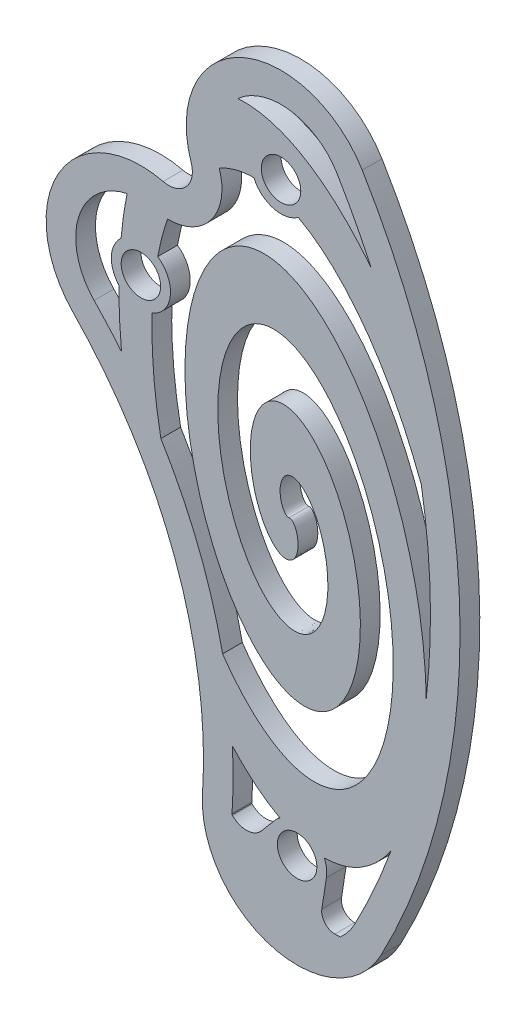
from build123d import *

# Parameters (mm, degrees)
SKETCH1_R             = 3
SKETCH1_R_2           = 2
BOSS_EXTRUDE1_DEPTH   = 2
BOSS_EXTRUDE1_2_DEPTH = 2
SKETCH2_R             = 2
BOSS_EXTRUDE2_DEPTH   = 2
SKETCH3_R             = 2
BOSS_EXTRUDE3_DEPTH   = 2
BOSS_EXTRUDE4_START   = -2
BOSS_EXTRUDE4_DEPTH   = 2
BOSS_EXTRUDE5_START   = -2
BOSS_EXTRUDE5_DEPTH   = 2


# Read off the part's stored shape, not the designer's step: Boss-Extrude4
with BuildPart() as part:
    # Sketch1 → Boss-Extrude1 (new body)
    with BuildSketch(Plane.XY):
        with Locations((10, 29.870554062)):
            Circle(SKETCH1_R)
        with Locations((10, 29.870554062)):
            Circle(SKETCH1_R_2, mode=Mode.SUBTRACT)
    extrude(amount=BOSS_EXTRUDE1_DEPTH)



with BuildPart() as body_2:
    # Sketch1 → Boss-Extrude1 2 (new body)
    with BuildSketch(Plane.XY):
        with BuildLine():
            ThreePointArc((15.091212356, 42.293512153), (14.584137621, 39.9164312), (12.258800619, 39.209008787))
            ThreePointArc((12.258800619, 39.209008787), (1.657748338, 34.63665877), (3.102421083, 23.182331432))
            ThreePointArc((3.102421083, 23.182331432), (13.45947408, 6.707290479), (16.245943176, -12.552281456))
            ThreePointArc((16.245943176, -12.552281456), (23.216428529, -22.421663779), (34.325745067, -17.67029981))
            ThreePointArc((34.325745067, -17.67029981), (42.319361068, 16.562449764), (32.432857738, 50.297240295))
            ThreePointArc((32.432857738, 50.297240295), (20.177538702, 54.061889951), (15.091212356, 42.293512153))
        make_face()
        with BuildLine():
            ThreePointArc((5.256175124, 25.270714426), (4.262598307, 33.148452924), (11.55349503, 36.293096575))
            ThreePointArc((11.55349503, 36.293096575), (16.793832724, 37.887331017), (17.936567237, 43.244277949))
            ThreePointArc((17.936567237, 43.244277949), (21.434699226, 51.338005331), (29.863321501, 48.748859357))
            ThreePointArc((29.863321501, 48.748859357), (39.320523815, 16.478932529), (31.674014102, -16.267330498))
            ThreePointArc((31.674014102, -16.267330498), (24.033557532, -19.535091384), (19.239591096, -12.747402263))
            ThreePointArc((19.239591096, -12.747402263), (16.275061788, 7.742889755), (5.256175124, 25.270714426))
        make_face(mode=Mode.SUBTRACT)
    extrude(amount=BOSS_EXTRUDE1_2_DEPTH)


with BuildPart() as body_3:
    # Sketch2 → Boss-Extrude2 (new body)
    with BuildSketch(Plane.XY.offset(2)):
        with BuildLine():
            ThreePointArc((22.87015374, -12.708717616), (22.833523349, -13.209136305), (22.880808412, -13.708660853))
            ThreePointArc((22.880808412, -13.708660853), (22.954091233, -14.019699042), (23.06004252, -14.321177817))
            ThreePointArc((23.06004252, -14.321177817), (23.289499578, -14.767395375), (23.590116881, -15.169128978))
            ThreePointArc((23.590116881, -15.169128978), (23.814721384, -15.396434816), (24.062229535, -15.598560624))
            ThreePointArc((24.062229535, -15.598560624), (24.490566436, -15.859880639), (24.956465651, -16.046156166))
            ThreePointArc((24.956465651, -16.046156166), (25.266605535, -16.123152136), (25.583175807, -16.166722649))
            ThreePointArc((25.583175807, -16.166722649), (26.084933355, -16.166604906), (26.579653345, -16.082862552))
            ThreePointArc((26.579653345, -16.082862552), (26.884489132, -15.986996656), (27.177398598, -15.859250142))
            ThreePointArc((27.177398598, -15.859250142), (27.605612807, -15.597729127), (27.984250876, -15.268496894))
            ThreePointArc((27.984250876, -15.268496894), (28.194496651, -15.027848101), (28.377952594, -14.766201309))
            ThreePointArc((28.377952594, -14.766201309), (28.607200206, -14.319876111), (28.758853867, -13.841585594))
            ThreePointArc((28.758853867, -13.841585594), (28.814670087, -13.511460777), (28.833353061, -13.177172292))
            ThreePointArc((28.833353061, -13.177172292), (26.068302031, -10.186386612), (22.87015374, -12.708717616))
        make_face()
        with Locations((25.833353061, -13.177172292)):
            Circle(SKETCH2_R, mode=Mode.SUBTRACT)
    extrude(amount=-BOSS_EXTRUDE2_DEPTH)


with BuildPart() as body_4:
    # Sketch3 → Boss-Extrude3 (new body)
    with BuildSketch(Plane.XY.offset(2)):
        with BuildLine():
            ThreePointArc((21.213127456, 45.100789395), (21.294560788, 44.60568409), (21.457372687, 44.131075898))
            ThreePointArc((21.457372687, 44.131075898), (24.820553864, 42.402522494), (27.20370128, 45.338419783))
            ThreePointArc((27.20370128, 45.338419783), (27.135154617, 45.976057091), (26.932647056, 46.584555792))
            ThreePointArc((26.932647056, 46.584555792), (26.686788767, 47.021950754), (26.371470065, 47.412251621))
            ThreePointArc((26.371470065, 47.412251621), (25.927248759, 47.793900202), (25.417343402, 48.081970912))
            ThreePointArc((25.417343402, 48.081970912), (25.183659323, 48.173853124), (24.943110029, 48.245871365))
            ThreePointArc((24.943110029, 48.245871365), (24.614103786, 48.3102155), (24.279972743, 48.33745007))
            ThreePointArc((24.279972743, 48.33745007), (23.779067576, 48.308215435), (23.290040859, 48.195905502))
            ThreePointArc((23.290040859, 48.195905502), (22.976930544, 48.076125676), (22.679139226, 47.922159426))
            ThreePointArc((22.679139226, 47.922159426), (22.269839548, 47.631927751), (21.91463657, 47.277538848))
            ThreePointArc((21.91463657, 47.277538848), (21.7125776, 47.010036608), (21.541625922, 46.721660466))
            ThreePointArc((21.541625922, 46.721660466), (21.348319465, 46.258634263), (21.234887762, 45.769866527))
            ThreePointArc((21.234887762, 45.769866527), (21.205286628, 45.435936821), (21.213127456, 45.100789395))
        make_face()
        with Locations((24.20370128, 45.338419783)):
            Circle(SKETCH3_R, mode=Mode.SUBTRACT)
    extrude(amount=-BOSS_EXTRUDE3_DEPTH)


with BuildPart() as part_1:
    add(part.part)

    add(body_2.part)  # Boss-Extrude4 merges body 2

    add(body_3.part)  # Boss-Extrude4 merges body 3

    add(body_4.part)  # Boss-Extrude4 merges body 4
    # Boss-Extrude4 outline → Boss-Extrude4 (add)
    with BuildSketch(Plane(origin=(0, 0, 0), x_dir=(-1, 0, 0), z_dir=(0, 0, -1)).offset(BOSS_EXTRUDE4_START)):
        with BuildLine():
            ThreePointArc((-28.58514535, -11.982333724), (-26.633604436, -10.285875396), (-24.087522739, -10.737484507))
            add(Edge.make_bspline(
                [(-24.087522739, -10.737484507), (-23.597444838, -10.473454504), (-22.53325726, -9.81907558), (-21.297213455, -8.858268085), (-20.168950346, -7.779397806), (-19.483061822, -7.048046859), (-19.273300207, -6.81706491)],
                knots=[0.317368676, 0.317368676, 0.317368676, 0.317368676, 0.317368676, 0.321512116, 0.326650739, 0.328972522, 0.328972522, 0.328972522, 0.328972522, 0.328972522], degree=4))
            ThreePointArc((-19.273300207, -6.81706491), (-18.921825691, -3.008226651), (-18.27990932, 0.762546027))
            add(Edge.make_bspline(
                [(-25.018527171, 16.080623746), (-25.007693139, 16.078235173), (-24.985741755, 16.075058431), (-24.942847658, 16.07307706), (-24.896403955, 16.081542367), (-24.848675665, 16.096715556), (-24.804135478, 16.117926692), (-24.751377729, 16.150118281), (-24.696796768, 16.192961191), (-24.641479104, 16.246409134), (-24.586326833, 16.310319075), (-24.538555941, 16.373994177), (-24.483551758, 16.456892678), (-24.424263096, 16.560566209), (-24.365238704, 16.682417076), (-24.308356773, 16.822644776), (-24.249016227, 16.995981312), (-24.192586764, 17.203687492), (-24.144403071, 17.450166622), (-24.104136519, 17.806715376), (-24.101883621, 18.165931867), (-24.139854562, 18.523591015), (-24.226489558, 18.874327088), (-24.33077849, 19.146942428), (-24.477510007, 19.402471036), (-24.675295001, 19.625265165), (-24.908646735, 19.776705896), (-25.154324783, 19.848802012), (-25.387193511, 19.857070622), (-25.5958073, 19.824140216), (-25.832853097, 19.74670586), (-26.089087017, 19.61493629), (-26.429547099, 19.37295286), (-26.819659272, 18.988181092), (-27.210071761, 18.483230462), (-27.605704192, 17.830707156), (-27.953760548, 17.113710635), (-28.255337087, 16.33911261), (-28.509025798, 15.511834862), (-28.706449013, 14.669389397), (-28.849196058, 13.816090633), (-28.959084041, 12.740077117), (-28.97398092, 11.651856328), (-28.882341342, 10.5602765), (-28.657642355, 9.483462588), (-28.378704316, 8.63805265), (-28.029107016, 7.937930277), (-27.633329616, 7.39174831), (-27.14774402, 6.919433306), (-26.625210825, 6.585130114), (-25.981008244, 6.391589382), (-25.266867426, 6.399539843), (-24.640446567, 6.550441282), (-23.955244965, 6.852871052), (-23.241973748, 7.324790248), (-22.327413604, 8.142862932), (-21.319782187, 9.387113747), (-20.35213267, 10.981801334), (-19.539097058, 12.769414914), (-18.940149837, 14.462435063), (-18.407330909, 16.38531453), (-17.985540992, 18.540869552), (-17.73171818, 21.093654501), (-17.79248824, 23.630699448), (-18.107028258, 25.749714837), (-18.578852642, 27.429297472), (-19.087157173, 28.680098268), (-19.782798729, 29.8642487), (-20.713909679, 30.907481282), (-21.849685109, 31.622280614), (-23.086602526, 31.907196227), (-24.52163539, 31.808934883), (-25.914685039, 31.281275211), (-27.256619811, 30.389302912), (-28.529473149, 29.201057105), (-29.572315479, 27.980093833), (-30.73619453, 26.345509965), (-31.935476279, 24.255824652), (-33.162286863, 21.541082505), (-34.129510468, 18.634937931), (-34.783871494, 15.970714879), (-35.201268829, 13.581951731), (-35.436556336, 11.65637596), (-35.602860885, 9.237011339), (-35.586694761, 6.745242943), (-35.348119564, 4.197535437), (-34.811158782, 1.629939214), (-34.125630672, -0.46383912), (-33.143507533, -2.442469955), (-31.786991446, -4.193550884), (-30.040271719, -5.449646807), (-28.035645542, -5.955810981), (-25.773038611, -5.714469287), (-23.493037163, -4.689598277), (-21.261248667, -2.940184163), (-19.688834894, -1.174306293), (-18.740035252, 0.094799491), (-18.27990932, 0.762546027)],
                knots=[0.010656411, 0.010656411, 0.010656411, 0.010656411, 0.010656411, 0.010720232, 0.010784053, 0.010847874, 0.010911695, 0.010975516, 0.011039337, 0.011166979, 0.011269874, 0.011372768, 0.011475663, 0.011578557, 0.011784347, 0.011990136, 0.012175564, 0.012360991, 0.012731847, 0.013102702, 0.013473558, 0.014215269, 0.014586124, 0.01495698, 0.015338869, 0.015720757, 0.016102646, 0.016484535, 0.016756286, 0.017028037, 0.017299788, 0.01757154, 0.018042056, 0.018512572, 0.019453605, 0.020394637, 0.02133567, 0.022454002, 0.023572334, 0.024690666, 0.025808998, 0.02692733, 0.028045662, 0.030282326, 0.031430663, 0.032578999, 0.033727335, 0.034875672, 0.035462208, 0.036048744, 0.037221817, 0.038049746, 0.038877674, 0.039705603, 0.040533532, 0.041908376, 0.04328322, 0.046032909, 0.048782597, 0.051532286, 0.053424027, 0.055315767, 0.059099249, 0.06288273, 0.066666211, 0.068408301, 0.07015039, 0.07189248, 0.073634569, 0.075479769, 0.077324969, 0.078704993, 0.080085017, 0.082845065, 0.084919032, 0.086992999, 0.089066966, 0.091140933, 0.095288867, 0.099436801, 0.104453044, 0.106961165, 0.109469287, 0.111977409, 0.11448553, 0.119501773, 0.122345256, 0.125188738, 0.128032221, 0.130875703, 0.133715785, 0.136555866, 0.138933934, 0.141312002, 0.145308402, 0.149304803, 0.153500397, 0.153500397, 0.153500397, 0.153500397, 0.153500397], degree=4))
            add(Edge.make_bspline(
                [(-25.018527171, 16.080623746), (-25.02715625, 16.082526194), (-25.044642839, 16.085326577), (-25.078082508, 16.087953169), (-25.116311163, 16.08423554), (-25.164379324, 16.073392598), (-25.219515844, 16.051573391), (-25.269564641, 16.022090508), (-25.315140957, 15.987975819), (-25.349854392, 15.95784282), (-25.375283814, 15.933677945), (-25.405812822, 15.902205058), (-25.440553073, 15.862672708), (-25.478566204, 15.814449637), (-25.518929912, 15.75705662), (-25.556518261, 15.697817119), (-25.591582877, 15.637056132), (-25.632513287, 15.559507002), (-25.677335498, 15.464282864), (-25.737295449, 15.318218303), (-25.801611377, 15.123367831), (-25.858621857, 14.895474938), (-25.913437043, 14.570738969), (-25.941023248, 14.182597387), (-25.921788853, 13.793275848), (-25.848452905, 13.410463387), (-25.744500942, 13.107171872), (-25.633492574, 12.880731353), (-25.491254803, 12.676578945), (-25.315655677, 12.504745265), (-25.102639079, 12.376132645), (-24.860588316, 12.307373701), (-24.607204515, 12.304091804), (-24.358132498, 12.357382356), (-24.083786961, 12.468970442), (-23.795660434, 12.646187185), (-23.422087191, 12.956173782), (-23.003010526, 13.431126371), (-22.590191722, 14.042794163), (-22.207382133, 14.772795084), (-21.895213717, 15.51514069), (-21.642292514, 16.260212333), (-21.440958987, 17.001686457), (-21.28330835, 17.75367934), (-21.168728548, 18.513362482), (-21.079877933, 19.469684685), (-21.065780766, 20.476299848), (-21.146514988, 21.526540095), (-21.357456924, 22.604620028), (-21.612972523, 23.398107539), (-21.917210459, 24.044917108), (-22.23512238, 24.539217742), (-22.528061967, 24.896173744), (-22.86119924, 25.205945549), (-23.23246414, 25.457091675), (-23.692815511, 25.66287798), (-24.243509557, 25.776286889), (-24.861963774, 25.750818462), (-25.509641693, 25.571570502), (-26.22183902, 25.229643397), (-26.964179096, 24.703074415), (-27.708755187, 23.993747176), (-28.437728047, 23.108785369), (-29.080720072, 22.160537262), (-29.649638091, 21.166495821), (-30.152847241, 20.13784721), (-30.596284239, 19.082224875), (-31.005603782, 17.945386888), (-31.373414058, 16.728100556), (-31.774873333, 15.091860931), (-32.125241081, 13.022376178), (-32.313501498, 10.578297886), (-32.207039997, 8.153474504), (-31.867211427, 6.130580539), (-31.384900596, 4.528514142), (-30.873825639, 3.33520538), (-30.186067931, 2.210534599), (-29.27831268, 1.224736673), (-28.128578085, 0.511139745), (-26.800126331, 0.225320369), (-25.501271308, 0.376826286), (-24.325480901, 0.819255327), (-23.270971212, 1.447274992), (-22.328976262, 2.190368897), (-21.444072236, 3.049663514), (-20.614443629, 4.007390324), (-19.837633778, 5.051456615), (-19.111440999, 6.171709054), (-17.95367888, 8.201335388), (-16.781050847, 10.836113357), (-15.708400158, 14.090378263), (-14.884572305, 17.969782461), (-14.472767187, 21.45155788), (-14.407791796, 24.677475619), (-14.64307922, 27.613726267), (-15.140948697, 30.23190472), (-15.85364842, 32.508810786), (-16.882522332, 34.605647631), (-18.294964574, 36.405115599), (-20.100975561, 37.659295923), (-22.142523086, 38.133161227), (-24.151085316, 37.866027541), (-25.960518804, 37.111247359), (-27.593747138, 36.027219863), (-29.061311523, 34.726048617), (-30.580987482, 33.054768993), (-32.097515634, 30.995544261), (-33.565626129, 28.546217977), (-34.943436372, 25.710780851), (-36.381523584, 22.0780426), (-37.704414938, 17.604048403), (-38.519852838, 13.269474117), (-38.844333503, 9.666242895), (-38.904120968, 7.595707367), (-38.910845395, 7.066410413)],
                knots=[0.010914474, 0.010914474, 0.010914474, 0.010914474, 0.010914474, 0.010987589, 0.011060704, 0.011133819, 0.011206934, 0.011353163, 0.011499393, 0.011564625, 0.011629856, 0.011695088, 0.01176032, 0.011890783, 0.012021246, 0.012151709, 0.012282173, 0.012412636, 0.012543099, 0.012804026, 0.013064952, 0.013586805, 0.014068398, 0.014549992, 0.015513178, 0.016476365, 0.016957958, 0.017439551, 0.017893276, 0.018347001, 0.018800726, 0.019254451, 0.019725232, 0.020196012, 0.020666793, 0.021137573, 0.021920033, 0.022702494, 0.024267414, 0.025832335, 0.027397255, 0.028825678, 0.030254101, 0.031682524, 0.033110947, 0.03453937, 0.035967793, 0.03882464, 0.040591785, 0.04235893, 0.044126075, 0.045009648, 0.04589322, 0.046723163, 0.047553105, 0.048383048, 0.04921299, 0.050454842, 0.051696693, 0.052938545, 0.054180397, 0.056309217, 0.058438037, 0.060566857, 0.062695677, 0.064824497, 0.066953317, 0.069082137, 0.071210957, 0.073811042, 0.076411127, 0.081611297, 0.086811467, 0.092011638, 0.094420528, 0.096829418, 0.099238308, 0.101647198, 0.104183469, 0.10671974, 0.109135164, 0.111550587, 0.113777909, 0.11600523, 0.118232551, 0.120459873, 0.122942097, 0.125424322, 0.127906547, 0.130388772, 0.140317671, 0.146830475, 0.15334328, 0.159856084, 0.166368889, 0.170795557, 0.175222225, 0.179648893, 0.184075561, 0.18807867, 0.19208178, 0.195679091, 0.199276402, 0.202916964, 0.206557525, 0.210198087, 0.213838649, 0.219696772, 0.225554895, 0.231413017, 0.23727114, 0.248743139, 0.260215138, 0.26415376, 0.26415376, 0.26415376, 0.26415376, 0.26415376], degree=4))
            ThreePointArc((-38.910845395, 7.066410413), (-37.570919275, -0.575677237), (-35.344599141, -8.008066108))
            add(Edge.make_bspline(
                [(-35.344599141, -8.008066108), (-35.038366307, -8.451935312), (-34.359646964, -9.328418808), (-33.165980308, -10.518854803), (-31.37153567, -11.561039262), (-29.890693837, -11.920718428), (-28.954313952, -11.982269731), (-28.58514535, -11.982333724)],
                knots=[0.293395109, 0.293395109, 0.293395109, 0.293395109, 0.293395109, 0.297406501, 0.301628481, 0.305850461, 0.308598635, 0.308598635, 0.308598635, 0.308598635, 0.308598635], degree=4))
        make_face()
        with BuildLine():
            add(Edge.make_bspline(
                [(-12.026193513, 16.53135767), (-11.900147355, 17.178507292), (-11.641175249, 18.643580109), (-11.327894248, 20.939545581), (-11.135724391, 23.591291721), (-11.108256938, 25.589482158), (-11.135956039, 26.75827765), (-11.147857312, 27.098835536)],
                knots=[0.175589591, 0.175589591, 0.175589591, 0.175589591, 0.175589591, 0.179000817, 0.183286085, 0.18757151, 0.18933459, 0.18933459, 0.18933459, 0.18933459, 0.18933459], degree=4))
            ThreePointArc((-12.026193513, 16.53135767), (-10.127760561, 19.411706907), (-8.035036681, 22.154144903))
            add(Edge.make_bspline(
                [(-8.035036681, 22.154144903), (-8.028290143, 22.225430192), (-7.943194818, 23.140121249), (-7.840161447, 24.563657886), (-7.783846997, 25.990135053), (-7.775486757, 27.345609263), (-7.778902435, 27.853941653)],
                knots=[0.387673038, 0.387673038, 0.387673038, 0.387673038, 0.387673038, 0.388205835, 0.394508544, 0.398291075, 0.398291075, 0.398291075, 0.398291075, 0.398291075], degree=4))
            ThreePointArc((-7.778902435, 27.853941653), (-9.343869318, 26.943184505), (-11.147857312, 27.098835536))
        make_face()
        with BuildLine():
            ThreePointArc((-30.216818686, -18.121626584), (-22.98756915, -19.140720989), (-19.232292629, -12.879850402))
            add(Edge.make_bspline(
                [(-30.216818686, -18.121626584), (-29.807351665, -18.15012079), (-28.621832224, -18.159561655), (-26.677522573, -17.837456371), (-24.150527194, -16.788365943), (-21.870621218, -15.272012041), (-20.384556636, -14.002060655), (-19.529895182, -13.178333731), (-19.232292629, -12.879850402)],
                knots=[0.315907599, 0.315907599, 0.315907599, 0.315907599, 0.315907599, 0.318031809, 0.322032451, 0.325992033, 0.329951616, 0.332132389, 0.332132389, 0.332132389, 0.332132389, 0.332132389], degree=4))
        make_face()
        with BuildLine():
            ThreePointArc((-33.345218925, 42.155744752), (-36.419099435, 34.089458391), (-38.415422816, 25.691338959))
            add(Edge.make_bspline(
                [(-25.949452032, 42.89867506), (-26.157547086, 42.786579488), (-26.871597571, 42.379310698), (-28.037770945, 41.585891034), (-29.555844312, 40.288843843), (-31.392148042, 38.349566286), (-33.222211511, 35.977384186), (-34.99974048, 33.172100929), (-36.580622312, 30.133027587), (-37.588468314, 27.830379653), (-38.173417241, 26.339061976), (-38.415422816, 25.691338959)],
                knots=[0.223744204, 0.223744204, 0.223744204, 0.223744204, 0.223744204, 0.224967098, 0.227995735, 0.231024371, 0.234053008, 0.238762642, 0.243472275, 0.248181909, 0.251759476, 0.251759476, 0.251759476, 0.251759476, 0.251759476], degree=4))
            ThreePointArc((-25.949452032, 42.89867506), (-25.004043749, 48.229691464), (-21.451872673, 44.143664864))
            add(Edge.make_bspline(
                [(-17.939661015, 43.234991178), (-18.387696863, 43.482637556), (-19.2294943, 43.854825317), (-20.130488926, 44.077931065), (-21.046979846, 44.143743938), (-21.451872673, 44.143664864)],
                knots=[0.212902532, 0.212902532, 0.212902532, 0.212902532, 0.212902532, 0.215550737, 0.217646157, 0.217646157, 0.217646157, 0.217646157, 0.217646157], degree=4))
            ThreePointArc((-17.939661015, 43.234991178), (-17.938116233, 43.239635266), (-17.936567237, 43.244277949))
            ThreePointArc((-17.936567237, 43.244277949), (-17.820575888, 47.046667236), (-19.820229944, 50.282869012))
            add(Edge.make_bspline(
                [(-19.820229944, 50.282869012), (-20.237121076, 50.311938845), (-21.372376169, 50.319902748), (-23.55599557, 49.971840898), (-26.559305717, 48.640753025), (-29.413359337, 46.50193661), (-31.50113751, 44.388305512), (-32.732575259, 42.929981856), (-33.261357909, 42.26264837), (-33.345218925, 42.155744752)],
                knots=[0.449913685, 0.449913685, 0.449913685, 0.449913685, 0.449913685, 0.453023108, 0.458346073, 0.466206917, 0.47406776, 0.479391958, 0.480402931, 0.480402931, 0.480402931, 0.480402931, 0.480402931], degree=4))
        make_face()
        with BuildLine():
            add(Edge.make_bspline(
                [(-11.705312114, 32.338733674), (-11.856570844, 33.150261991), (-12.072169502, 34.111281477), (-12.334354753, 35.061354166), (-12.650883106, 35.993404576), (-12.703383921, 36.1432229)],
                knots=[0.196156756, 0.196156756, 0.196156756, 0.196156756, 0.196156756, 0.200427782, 0.20124909, 0.20124909, 0.20124909, 0.20124909, 0.20124909], degree=4))
            ThreePointArc((-11.705312114, 32.338733674), (-9.803909026, 32.864138591), (-7.987290969, 32.095189394))
            add(Edge.make_bspline(
                [(-7.987290969, 32.095189394), (-7.998878254, 32.218461248), (-8.093280971, 33.184738269), (-8.228270117, 34.246754086), (-8.400101231, 35.303521637), (-8.58410229, 36.231784515), (-8.603764814, 36.329108579)],
                knots=[0.406192688, 0.406192688, 0.406192688, 0.406192688, 0.406192688, 0.407113963, 0.413416672, 0.414155485, 0.414155485, 0.414155485, 0.414155485, 0.414155485], degree=4))
            ThreePointArc((-8.603764814, 36.329108579), (-10.080665239, 36.477814634), (-11.55349503, 36.293096575))
            ThreePointArc((-11.55349503, 36.293096575), (-12.124399603, 36.187164272), (-12.703383921, 36.1432229))
        make_face()
    extrude(amount=BOSS_EXTRUDE4_DEPTH)

    # Sketch5 → Boss-Extrude5 (add)
    with BuildSketch(Plane(origin=(0, 0, 0), x_dir=(-1, 0, 0), z_dir=(0, 0, -1)).offset(BOSS_EXTRUDE5_START)):
        with BuildLine():
            Line((-23.537539039, -11.246048791), (-22.227483537, -12.803506815))
            ThreePointArc((-22.227483537, -12.803506815), (-20.78411578, -13.514190378), (-19.28433753, -12.931913117))
            ThreePointArc((-19.28433753, -12.931913117), (-22.352765606, -19.760984308), (-29.662586287, -18.142965215))
            ThreePointArc((-29.662586287, -18.142965215), (-28.644674083, -17.681779583), (-28.336779568, -16.607517785))
            Line((-28.336779568, -16.607517785), (-28.797847335, -13.637361057))
            ThreePointArc((-28.797847335, -13.637361057), (-24.591831049, -15.908220276), (-23.537539039, -11.246048791))
        make_face()
    extrude(amount=BOSS_EXTRUDE5_DEPTH)


solid = part_1.part
